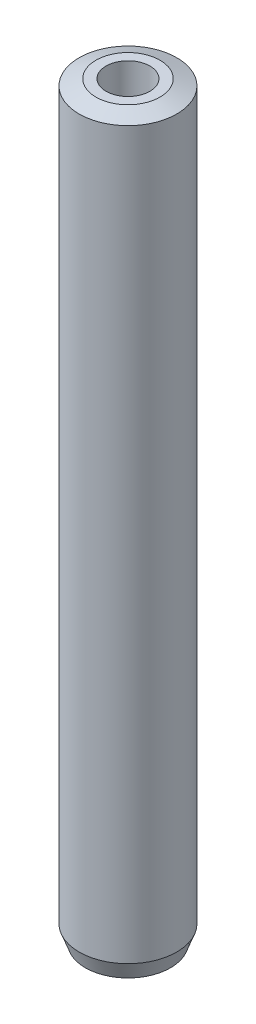
from build123d import *
from OCP.BRepFilletAPI import BRepFilletAPI_MakeChamfer

# Parameters (mm, degrees)
SKETCH1_R           = 22.5
BOSS_EXTRUDE1_DEPTH = 345.192541881
SKETCH2_R           = 10.108606879
CUT_EXTRUDE1_DEPTH  = 347.656012454
CHAMFER1_SIZE       = 2.875041801
CHAMFER1_SIZE2      = 7.746379801


with BuildPart() as part:
    # Sketch1 → Boss-Extrude1 (new body)
    with BuildSketch(Plane(origin=(0, 0, 0), x_dir=(1, 0, 0), z_dir=(0, 1, 0))):
        Circle(SKETCH1_R)
    extrude(amount=BOSS_EXTRUDE1_DEPTH)

    # Sketch2 → Cut-Extrude1 (cut, through all)
    with BuildSketch(Plane(origin=(0, 0, 0), x_dir=(1, 0, 0), z_dir=(0, 1, 0))):
        Circle(SKETCH2_R)
    extrude(amount=CUT_EXTRUDE1_DEPTH, mode=Mode.SUBTRACT)

    # Chamfer1: one chamfer whose edges measure the first distance from different faces: ONE call of the kernel's chamfer builder (chamfer() names one face for all edges)
    chamfer1_edges_1 = [part.edges().sort_by_distance(p)[0] for p in [
        (-22.5, 345.192541881, 0),
    ]]
    chamfer1_side_1 = [part.faces().sort_by_distance(p)[0] for p in [
        (-22.5, 172.596270941, 0),
    ]]
    chamfer1_edges_2 = [part.edges().sort_by_distance(p)[0] for p in [
        (-22.5, 0, 0),
    ]]
    chamfer1_side_2 = [part.faces().sort_by_distance(p)[0] for p in [
        (-21.863603897, 0, 0),
    ]]
    chamfer1 = BRepFilletAPI_MakeChamfer(part.part.solid().wrapped)
    for e in chamfer1_edges_1:
        chamfer1.Add(CHAMFER1_SIZE, CHAMFER1_SIZE2, e.wrapped, chamfer1_side_1[0].wrapped)  # the first distance lies on this face
    for e in chamfer1_edges_2:
        chamfer1.Add(CHAMFER1_SIZE, CHAMFER1_SIZE2, e.wrapped, chamfer1_side_2[0].wrapped)  # the first distance lies on this face
    add(Compound.cast(chamfer1.Shape()), mode=Mode.REPLACE)


solid = part.part
